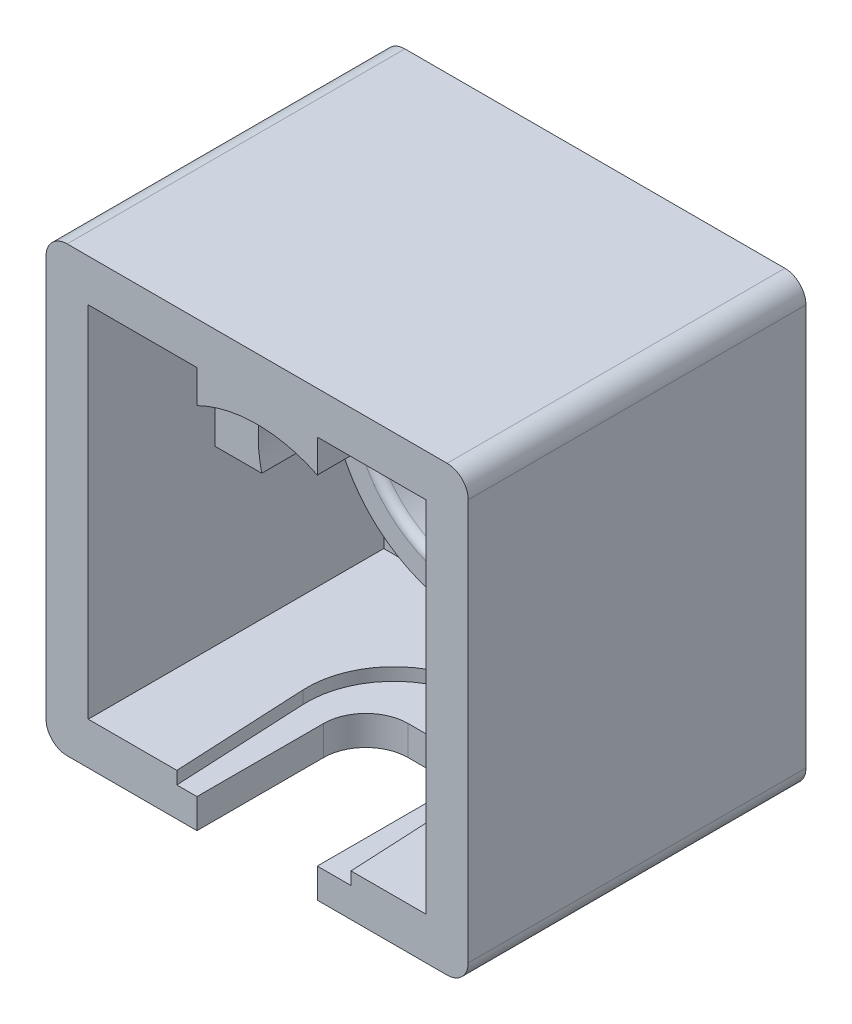
from build123d import *

# Parameters (mm, degrees)
SKETCH1_W            = 100
SKETCH1_H            = 105
BOSS_EXTRUDE1_DEPTH  = 10
SKETCH1_3_W          = 100
SKETCH1_3_H          = 105
SKETCH1_3_W_2        = 80
SKETCH1_3_H_2        = 85
BOSS_EXTRUDE2_DEPTH  = 70
SKETCH1_6_W          = 28.5
SKETCH1_6_H          = 10
CUT_EXTRUDE1_DEPTH   = 80
SKETCH1_7_W          = 28.5
SKETCH1_7_H          = 10
BOSS_EXTRUDE4_DEPTH  = 30
SKETCH1_8_R          = 2
CUT_EXTRUDE2_DEPTH   = 30
SKETCH1_9_R          = 4
CUT_EXTRUDE3_DEPTH   = 4
SKETCH1_11_R         = 32.5
SKETCH1_11_R_2       = 25.5
BOSS_EXTRUDE6_DEPTH  = 20
FILLET1_R            = 10
SKETCH1_12_R         = 4
BOSS_EXTRUDE7_DEPTH  = 19
BOSS_EXTRUDE13_DEPTH = 70
BOSS_EXTRUDE17_DEPTH = 40
CUT_EXTRUDE4_DEPTH   = 40
CUT_EXTRUDE5_DEPTH   = 3
FILLET2_R            = 5
FILLET3_R            = 2


with BuildPart() as part:
    # Sketch1 → Boss-Extrude1 (new body)
    with BuildSketch(Plane.XY):
        with Locations((40, -42.5)):
            Rectangle(SKETCH1_W, SKETCH1_H)
    extrude(amount=-BOSS_EXTRUDE1_DEPTH)

    # Sketch1<3> → Boss-Extrude2 (add)
    with BuildSketch(Plane.XY):
        with Locations((40, -42.5)):
            Rectangle(SKETCH1_3_W, SKETCH1_3_H)
        with Locations((40, -42.5)):
            Rectangle(SKETCH1_3_W_2, SKETCH1_3_H_2, mode=Mode.SUBTRACT)
    extrude(amount=BOSS_EXTRUDE2_DEPTH)

    # Sketch1<6> → Cut-Extrude1 (cut)
    with BuildSketch(Plane.XY):
        with Locations((40, -90)):
            Rectangle(SKETCH1_6_W, SKETCH1_6_H)
    extrude(amount=CUT_EXTRUDE1_DEPTH, mode=Mode.SUBTRACT)

    # Sketch1<7> → Boss-Extrude4 (add)
    with BuildSketch(Plane.XY):
        with Locations((40, -90)):
            Rectangle(SKETCH1_7_W, SKETCH1_7_H)
    extrude(amount=BOSS_EXTRUDE4_DEPTH)

    # Sketch1<8> → Cut-Extrude2 (cut)
    with BuildSketch(Plane.XY):
        with Locations((6, -6)):
            Circle(SKETCH1_8_R)
        with Locations((74, -79)):
            Circle(SKETCH1_8_R)
    extrude(amount=-CUT_EXTRUDE2_DEPTH, mode=Mode.SUBTRACT)

    # Sketch1<9> → Cut-Extrude3 (cut)
    with BuildSketch(Plane.XY):
        with Locations((6, -6)):
            Circle(SKETCH1_9_R)
        with Locations((74, -79)):
            Circle(SKETCH1_9_R)
    extrude(amount=-CUT_EXTRUDE3_DEPTH, mode=Mode.SUBTRACT)

    # Sketch1<11> → Boss-Extrude6 (add)
    with BuildSketch(Plane.XY):
        with Locations((40, -37)):
            Circle(SKETCH1_11_R)
        with Locations((40, -37)):
            Circle(SKETCH1_11_R_2, mode=Mode.SUBTRACT)
    extrude(amount=BOSS_EXTRUDE6_DEPTH)

    # Fillet1
    fillet1_edges = [part.edges().sort_by_distance(p)[0] for p in [
        (25.75, -90, 30),
        (54.25, -90, 30),
    ]]
    fillet(fillet1_edges, radius=FILLET1_R)

    # Sketch1<12> → Boss-Extrude7 (add)
    with BuildSketch(Plane.XY):
        with Locations((40, -20.887152182)):
            Circle(SKETCH1_12_R)
    extrude(amount=BOSS_EXTRUDE7_DEPTH)

    # Sketch1<18> → Boss-Extrude13 (add)
    with BuildSketch(Plane.XY):
        with BuildLine():
            Line((54.25, -7.790626504), (54.25, 0))
            Line((54.25, 0), (25.75, 0))
            Line((25.75, 0), (25.75, -7.790626504))
            ThreePointArc((25.75, -7.790626504), (40, -4.5), (54.25, -7.790626504))
        make_face()
    extrude(amount=BOSS_EXTRUDE13_DEPTH)

    # Sketch1<24> → Boss-Extrude17 (add)
    with BuildSketch(Plane.XY):
        with BuildLine():
            Line((80, -44), (80, -30))
            Line((80, -30), (68.9, -30))
            ThreePointArc((68.9, -30), (69.735668817, -37), (68.9, -44))
            Line((68.9, -44), (80, -44))
        make_face()
        with BuildLine():
            Line((0, -44), (11.1, -44))
            ThreePointArc((11.1, -44), (10.264331183, -37), (11.1, -30))
            Line((11.1, -30), (0, -30))
            Line((0, -30), (0, -44))
        make_face()
    extrude(amount=BOSS_EXTRUDE17_DEPTH)

    # Sketch1<25> → Cut-Extrude4 (cut)
    with BuildSketch(Plane.XY):
        with BuildLine():
            ThreePointArc((68.9, -44), (69.735668817, -37), (68.9, -30))
            Line((68.9, -30), (68.9, -44))
        make_face()
        with BuildLine():
            Line((11.1, -44), (11.1, -30))
            ThreePointArc((11.1, -30), (10.264331183, -37), (11.1, -44))
        make_face()
    extrude(amount=CUT_EXTRUDE4_DEPTH, mode=Mode.SUBTRACT)

    # Sketch2 → Cut-Extrude5 (cut)
    with BuildSketch(Plane(origin=(0, -85, 0), x_dir=(1, 0, 0), z_dir=(0, 1, 0))):
        with BuildLine():
            Line((60.575284083, -36.561798125), (62.82181371, -81.752405975))
            ThreePointArc((62.82181371, -81.752405975), (43.269374583, -103.350535014), (21.671245545, -83.798095887))
            Line((21.671245545, -83.798095887), (19.424715917, -38.607488037))
            ThreePointArc((19.424715917, -38.607488037), (38.977155044, -17.009358998), (60.575284083, -36.561798125))
        make_face()
    extrude(amount=-CUT_EXTRUDE5_DEPTH, mode=Mode.SUBTRACT)

    # Fillet2
    fillet2_edges = [part.edges().sort_by_distance(p)[0] for p in [
        (90, -95, 30),
        (90, 10, 30),
        (-10, 10, 30),
        (-10, -95, 30),
    ]]
    fillet(fillet2_edges, radius=FILLET2_R)

    # Fillet3
    fillet3_edges = [part.edges().sort_by_distance(p)[0] for p in [
        (14.5, -37, 20),
    ]]
    fillet(fillet3_edges, radius=FILLET3_R)


solid = part.part
